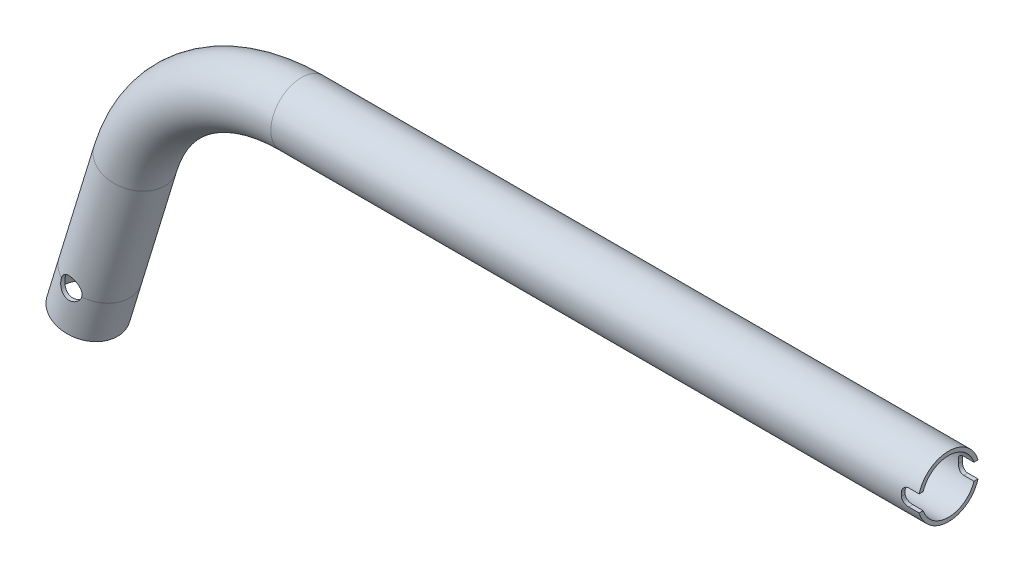
from build123d import *

# Parameters (mm, degrees)
SKETCH3_R          = 9.5
SKETCH3_R_2        = 8.3
CUT_EXTRUDE1_REACH = 191.877
SKETCH4_R          = 3.3
SKETCH5_R          = 3.3
CUT_EXTRUDE2_DEPTH = 190.876682823
CUT_EXTRUDE3_START = 10
CUT_EXTRUDE3_DEPTH = 10


with BuildPart() as part:
    # Sweep2: sweep along a path in Sketch1
    with BuildLine(Plane.XY) as sweep2_path:
        Line((108.839588828, 0), (92.239588828, 0))
        Line((92.239588828, 0), (-92.239588828, 0))
        ThreePointArc((-92.239588828, 0), (-124.360019313, -10.591729527), (-143.88004565, -38.211927945))
        Line((-143.88004565, -38.211927945), (-154.760411172, -73.8))
        Line((-154.760411172, -73.8), (-158.490325485, -86))
    # Sketch3 → Sweep2 (sweep)
    with BuildSketch(Plane(origin=(92.239588828, 0, 0), x_dir=(0, 0, -1), z_dir=(1, 0, 0))):
        Circle(SKETCH3_R)
        Circle(SKETCH3_R_2, mode=Mode.SUBTRACT)
    sweep(path=sweep2_path.line)

    # Sketch4 → Cut-Extrude1 (cut, up to next)
    with BuildSketch(Plane.XY, mode=Mode.PRIVATE) as cut_extrude1_sk1:
        with Locations((-154.760411172, -73.8)):
            Circle(SKETCH4_R)
    cut_extrude1_tool1 = extrude(cut_extrude1_sk1.sketch, amount=-CUT_EXTRUDE1_REACH, mode=Mode.PRIVATE) & part.part
    # Sketch4 → Cut-Extrude1 (cut, up to next)
    with BuildSketch(Plane.XY, mode=Mode.PRIVATE) as cut_extrude1_sk2:
        with BuildLine():
            Line((108.839588828, 2.555545653), (108.839588828, -2.555545653))
            Line((108.839588828, -2.555545653), (105.639588828, -2.555545653))
            ThreePointArc((105.639588828, -2.555545653), (104.225375266, -1.969759216), (103.639588828, -0.555545653))
            Line((103.639588828, -0.555545653), (103.639588828, 0.555545653))
            ThreePointArc((103.639588828, 0.555545653), (104.225375266, 1.969759216), (105.639588828, 2.555545653))
            Line((105.639588828, 2.555545653), (108.839588828, 2.555545653))
        make_face()
    cut_extrude1_tool2 = extrude(cut_extrude1_sk2.sketch, amount=-CUT_EXTRUDE1_REACH, mode=Mode.PRIVATE) & part.part
    # Sketch4 → Cut-Extrude1 (cut, up to next)
    with BuildSketch(Plane.XY, mode=Mode.PRIVATE) as cut_extrude1_sk3:
        with BuildLine():
            Line((90.239588828, -5.5), (94.239588828, -5.5))
            ThreePointArc((94.239588828, -5.5), (95.653802391, -4.914213562), (96.239588828, -3.5))
            Line((96.239588828, -3.5), (96.239588828, 3.5))
            ThreePointArc((96.239588828, 3.5), (95.653802391, 4.914213562), (94.239588828, 5.5))
            Line((94.239588828, 5.5), (90.239588828, 5.5))
            ThreePointArc((90.239588828, 5.5), (88.825375266, 4.914213562), (88.239588828, 3.5))
            Line((88.239588828, 3.5), (88.239588828, -3.5))
            ThreePointArc((88.239588828, -3.5), (88.825375266, -4.914213562), (90.239588828, -5.5))
        make_face()
    cut_extrude1_tool3 = extrude(cut_extrude1_sk3.sketch, amount=-CUT_EXTRUDE1_REACH, mode=Mode.PRIVATE) & part.part
    add(cut_extrude1_tool1.solids().sort_by_distance((-154.760411, -73.8, 0))[0], mode=Mode.SUBTRACT)
    add(cut_extrude1_tool2.solids().sort_by_distance((106.388287, 0, 0))[0], mode=Mode.SUBTRACT)
    add(cut_extrude1_tool3.solids().sort_by_distance((92.239589, 0, 0))[0], mode=Mode.SUBTRACT)

    # Sketch5 → Cut-Extrude2 (cut, through all)
    with BuildSketch(Plane.XY):
        with Locations((-154.760411172, -73.8)):
            Circle(SKETCH5_R)
    extrude(amount=CUT_EXTRUDE2_DEPTH, mode=Mode.SUBTRACT)

    # Sketch6 → Cut-Extrude3 (cut)
    with BuildSketch(Plane.XY.offset(CUT_EXTRUDE3_START)):
        with BuildLine():
            Line((108.839588828, 2.555545653), (105.639588828, 2.555545653))
            ThreePointArc((105.639588828, 2.555545653), (104.225375266, 1.969759216), (103.639588828, 0.555545653))
            Line((103.639588828, 0.555545653), (103.639588828, -0.555545653))
            ThreePointArc((103.639588828, -0.555545653), (104.225375266, -1.969759216), (105.639588828, -2.555545653))
            Line((105.639588828, -2.555545653), (108.839588828, -2.555545653))
            Line((108.839588828, -2.555545653), (108.839588828, 2.555545653))
        make_face()
    extrude(amount=-CUT_EXTRUDE3_DEPTH, mode=Mode.SUBTRACT)


solid = part.part
